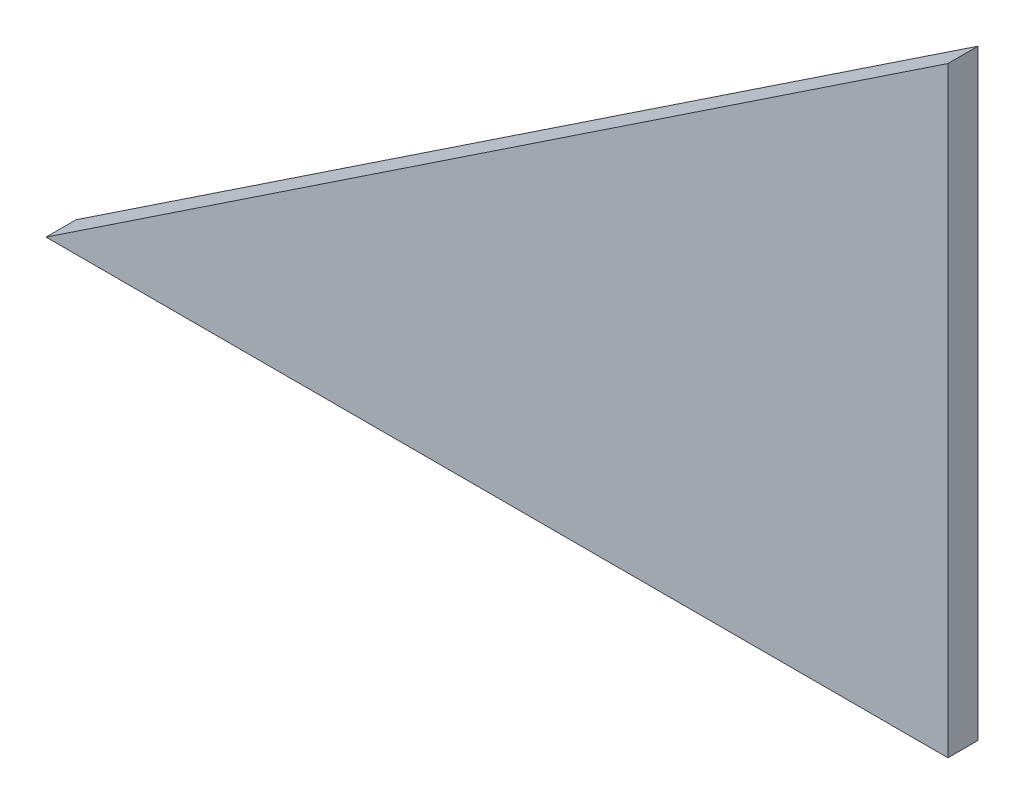
from build123d import *

# Parameters (mm, degrees)
BOSS_EXTRUDE1_DEPTH = 1.27


with BuildPart() as part:
    # Sketch1 → Boss-Extrude1 (new body)
    with BuildSketch(Plane(origin=(0, 0, 25.263986755), x_dir=(-1, 0, 0), z_dir=(0, 0, -1))):
        Polygon((-209.001631061, 11.960081074), (-209.001631061, 37.360081074), (-170.901631061, 11.960081074), align=None)
    extrude(amount=BOSS_EXTRUDE1_DEPTH)


solid = part.part
